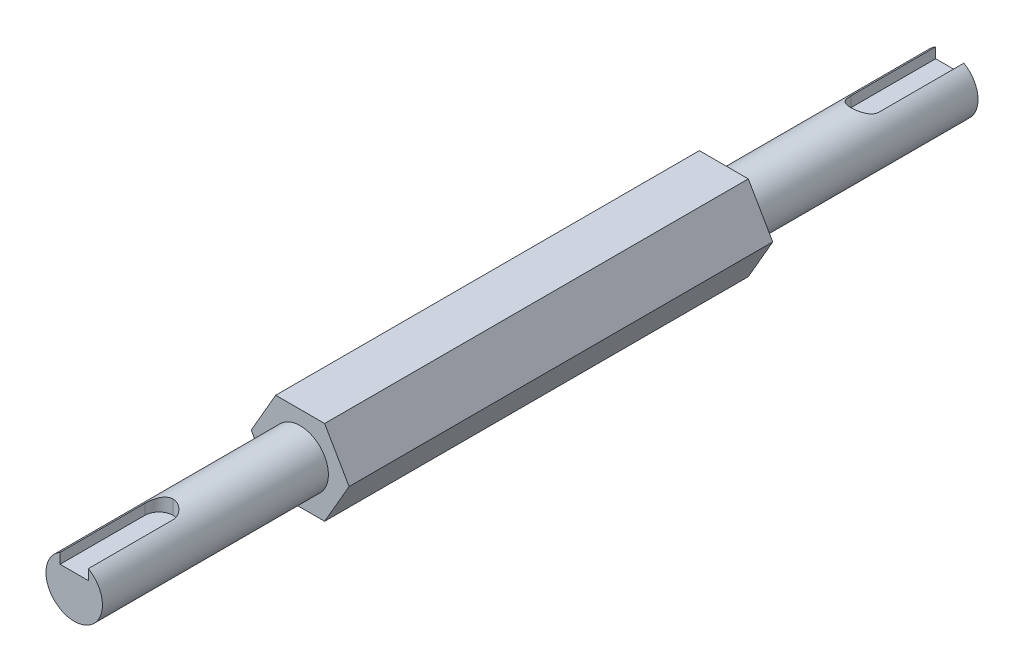
from build123d import *

# Parameters (mm, degrees)
BOSS_EXTRUDE1_DEPTH  = 75
SKETCH2_R            = 10
BOSS_EXTRUDE2_DEPTH  = 80
BOSS_EXTRUDE3_START  = 80
SKETCH3_R            = 10
BOSS_EXTRUDE3_DEPTH  = 80
SKETCH4_W            = 10
SKETCH4_H            = 18.646809019
CUT_EXTRUDE1_DEPTH   = 35
FILLET1_R            = 5
FILLET1_OF_MIRROR1_R = 5


with BuildPart() as part:
    # Sketch1 → Boss-Extrude1 (new, symmetric)
    with BuildSketch(Plane.XY):
        Polygon((8.660254038, 15), (-8.660254038, 15), (-17.320508076, 0), (-8.660254038, -15), (8.660254038, -15), (17.320508076, 0), align=None)
    extrude(amount=BOSS_EXTRUDE1_DEPTH, both=True)

    # Sketch2 → Boss-Extrude2 (add)
    with BuildSketch(Plane.XY.offset(75)):
        Circle(SKETCH2_R)
    extrude(amount=BOSS_EXTRUDE2_DEPTH)

    # Sketch3 → Boss-Extrude3 (add)
    with BuildSketch(Plane(origin=(0, 0, -75), x_dir=(-1, 0, 0), z_dir=(0, 0, -1)).offset(BOSS_EXTRUDE3_START)):
        with Locations(Location((0, 0, 0), (0, 0, 180))):
            Circle(SKETCH3_R)
    extrude(amount=-BOSS_EXTRUDE3_DEPTH)

    # Sketch4 → Cut-Extrude1 (cut)
    with BuildSketch(Plane.XY.offset(155)):
        with Locations((0, 14.32340451)):
            Rectangle(SKETCH4_W, SKETCH4_H)
    cut_extrude1 = extrude(amount=-CUT_EXTRUDE1_DEPTH, mode=Mode.SUBTRACT)

    # Fillet1
    fillet1_edges = [part.edges().sort_by_distance(p)[0] for p in [
        (5, 6.830127019, 120),
        (-5, 6.830127019, 120),
    ]]
    fillet(fillet1_edges, radius=FILLET1_R - 0.0001)  # a hair under: the kernel refuses the full size

    # Mirror1: Cut-Extrude1 across plane
    add(cut_extrude1.mirror(Plane.XY), mode=Mode.SUBTRACT)

    # Fillet1 of Mirror1
    fillet1_of_mirror1_edges = [part.edges().sort_by_distance(p)[0] for p in [
        (5, 6.830127019, -120),
        (-5, 6.830127019, -120),
    ]]
    fillet(fillet1_of_mirror1_edges, radius=FILLET1_OF_MIRROR1_R - 0.0001)  # a hair under: the kernel refuses the full size


solid = part.part
